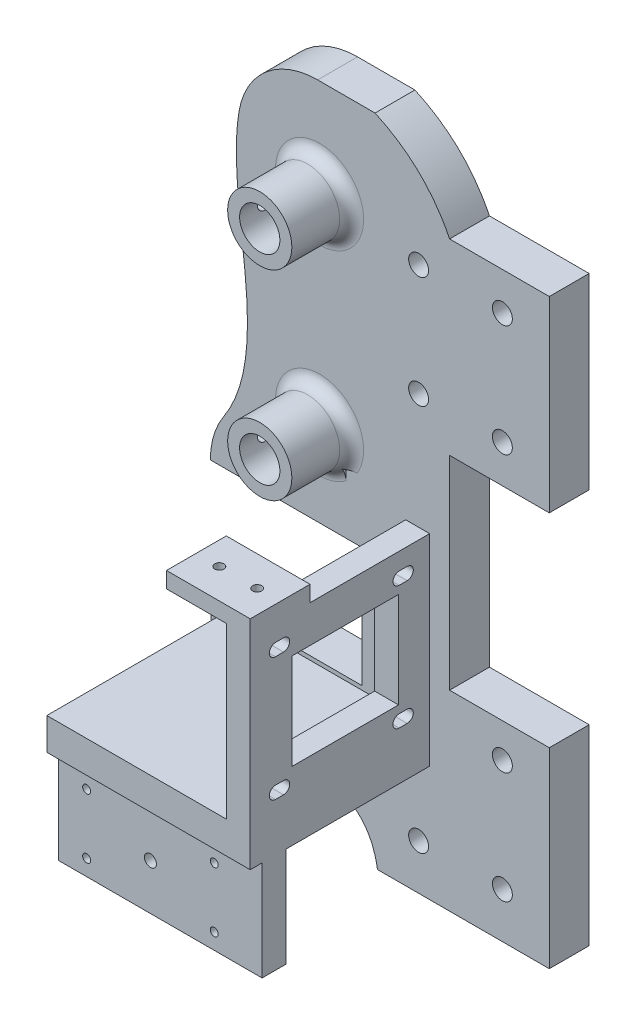
from build123d import *

# Parameters (mm, degrees)
SKETCH1_W               = 60
SKETCH1_H               = 145
BOSS_EXTRUDE1_DEPTH     = 10
BOSS_EXTRUDE2_DEPTH     = 45
SKETCH6_W               = 26.7
SKETCH6_H               = 24
CUT_EXTRUDE2_DEPTH      = 6
SKETCH8_R               = 1.15
CUT_EXTRUDE3_DEPTH      = 3
SKETCH9_W               = 60
SKETCH9_H               = 10
BOSS_EXTRUDE4_DEPTH     = 35
SKETCH12_W              = 6
SKETCH12_H              = 25
BOSS_EXTRUDE7_DEPTH     = 51
SKETCH13_R              = 8.05
SKETCH13_R_2            = 5.05
BOSS_EXTRUDE8_DEPTH     = 15
FILLET1_R               = 3
CUT_EXTRUDE4_REACH      = 160.348
CUT_EXTRUDE4_END_RADIUS = 8.05
SKETCH15_R              = 1.5
MIRROR1_START           = 9
MIRROR1_OUTLINE_R       = 8.05
MIRROR1_OUTLINE_R_2     = 5.05
MIRROR1_DEPTH           = 8.499999899
MIRROR1_START_2         = 20.499999166
MIRROR1_2_OUTLINE_R     = 8.05
MIRROR1_2_OUTLINE_R_2   = 5.05
MIRROR1_2_DEPTH         = 4.500000834
MIRROR1_START_3         = 17.499999899
MIRROR1_3_OUTLINE_R     = 8.05
MIRROR1_3_OUTLINE_R_2   = 5.05
MIRROR1_3_DEPTH         = 2.999999267
MIRROR1_START_4         = 18
MIRROR1_5_OUTLINE_R     = 1.5
MIRROR1_5_DEPTH         = 4.583753541
SKETCH17_W              = 10
SKETCH17_H              = 47
BOSS_EXTRUDE9_DEPTH     = 25
SKETCH18_W              = 10
SKETCH18_H              = 48
BOSS_EXTRUDE10_DEPTH    = 25
SKETCH19_R              = 2.5
CUT_EXTRUDE5_DEPTH      = 10
SKETCH20_W              = 60
SKETCH20_H              = 16
CUT_EXTRUDE6_DEPTH      = 10
CUT_EXTRUDE7_DEPTH      = 10
CUT_EXTRUDE8_DEPTH      = 10
FILLET2_R               = 20
CUT_EXTRUDE9_DEPTH      = 10
CUT_EXTRUDE10_DEPTH     = 101.361917618
CUT_EXTRUDE11_START     = -21
SKETCH26_W              = 30
SKETCH26_H              = 4
CUT_EXTRUDE11_DEPTH     = 21
SKETCH28_W              = 38
SKETCH28_H              = 30
CUT_EXTRUDE12_DEPTH     = 10
SKETCH29_R              = 1
SKETCH29_R_2            = 1.5
CUT_EXTRUDE13_DEPTH     = 12


with BuildPart() as part:
    # Sketch1 → Boss-Extrude1 (new body)
    with BuildSketch(Plane.XY):
        with Locations((30, 72.5)):
            Rectangle(SKETCH1_W, SKETCH1_H)
    extrude(amount=BOSS_EXTRUDE1_DEPTH)

    # Sketch2 → Boss-Extrude2 (add)
    with BuildSketch(Plane.XY.offset(10)):
        Polygon((4, 18), (49, 18), (49, 60.5), (34, 60.5), (34, 64.5), (55, 64.5), (55, 10), (4, 10), align=None)
    extrude(amount=BOSS_EXTRUDE2_DEPTH)

    # Sketch6 → Cut-Extrude2 (cut)
    with BuildSketch(Plane(origin=(55, 0, 0), x_dir=(0, 0, -1), z_dir=(1, 0, 0))):
        with Locations((-31.15, 39.2)):
            Rectangle(SKETCH6_W, SKETCH6_H)
    extrude(amount=-CUT_EXTRUDE2_DEPTH, mode=Mode.SUBTRACT)

    # Sketch8 → Cut-Extrude3 (cut)
    with BuildSketch(Plane(origin=(0, 64.5, 0), x_dir=(1, 0, 0), z_dir=(0, 1, 0))):
        with Locations(Location((49.25, -47.5, 0), (0, 0, 270))):
            Circle(SKETCH8_R)
        with Locations(Location((39.75, -47.5, 0), (0, 0, 270))):
            Circle(SKETCH8_R)
    extrude(amount=-CUT_EXTRUDE3_DEPTH, mode=Mode.SUBTRACT)

    # Sketch9 → Boss-Extrude4 (add)
    with BuildSketch(Plane.XZ):
        with Locations((30, 5)):
            Rectangle(SKETCH9_W, SKETCH9_H)
    extrude(amount=BOSS_EXTRUDE4_DEPTH)

    # Sketch12 → Boss-Extrude7 (add)
    with BuildSketch(Plane.ZY.offset(-4)):
        with Locations((49.02, -2.5)):
            Rectangle(SKETCH12_W, SKETCH12_H)
    extrude(amount=-BOSS_EXTRUDE7_DEPTH)

    # Sketch13 → Boss-Extrude8 (add)
    with BuildSketch(Plane.XY.offset(10)):
        with Locations(Location((27.39, 120.43, 0), (0, 0, 180))):
            Circle(SKETCH13_R)
        with Locations((27.39, 120.43)):
            Circle(SKETCH13_R_2, mode=Mode.SUBTRACT)
    extrude(amount=BOSS_EXTRUDE8_DEPTH)

    # Fillet1
    fillet1_edges = [part.edges().sort_by_distance(p)[0] for p in [
        (35.44, 120.43, 10),
    ]]
    fillet(fillet1_edges, radius=FILLET1_R)

    # Cut-Extrude4: up to this cylinder (the profile starts inside it)
    cut_extrude4_end = Plane(origin=(27.39, 120.43, 19), z_dir=(0, 0, -1)) * Cylinder(CUT_EXTRUDE4_END_RADIUS, 337.796, mode=Mode.PRIVATE)
    # Sketch15 → Cut-Extrude4 (cut, up to the surface)
    with BuildSketch(Plane.ZY.offset(-32), mode=Mode.PRIVATE) as cut_extrude4_sk1:
        with Locations(Location((19, 120.48, 0), (0, 0, 180))):
            Circle(SKETCH15_R)
    cut_extrude4_tool1 = extrude(cut_extrude4_sk1.sketch, amount=CUT_EXTRUDE4_REACH, mode=Mode.PRIVATE) & cut_extrude4_end
    add(cut_extrude4_tool1.solids().sort_by_distance((32, 120.48, 19))[0], mode=Mode.SUBTRACT)

    # Mirror1: read off the stored shape, not the designer's step
    # Mirror1 outline → Mirror1 (add)
    with BuildSketch(Plane.XY.offset(MIRROR1_START)):
        with Locations((27.39, 70.31)):
            Circle(MIRROR1_OUTLINE_R)
        with Locations((27.39, 70.31)):
            Circle(MIRROR1_OUTLINE_R_2, mode=Mode.SUBTRACT)
    extrude(amount=MIRROR1_DEPTH)



with BuildPart() as body_2:
    # Mirror1 2 outline → Mirror1 2 (new body)
    with BuildSketch(Plane.XY.offset(MIRROR1_START_2)):
        with Locations((27.39, 70.31)):
            Circle(MIRROR1_2_OUTLINE_R)
        with Locations((27.39, 70.31)):
            Circle(MIRROR1_2_OUTLINE_R_2, mode=Mode.SUBTRACT)
    extrude(amount=MIRROR1_2_DEPTH)


with BuildPart() as part_1:
    add(part.part)

    add(body_2.part)  # Mirror1 3 merges body 2
    # Mirror1 3 outline → Mirror1 3 (add)
    with BuildSketch(Plane.XY.offset(MIRROR1_START_3)):
        with Locations((27.39, 70.31)):
            Circle(MIRROR1_3_OUTLINE_R)
        with Locations((27.39, 70.31)):
            Circle(MIRROR1_3_OUTLINE_R_2, mode=Mode.SUBTRACT)
    extrude(amount=MIRROR1_3_DEPTH)

    # Mirror1 4 outline → Mirror1 4 (revolve)
    with BuildSketch(Plane(origin=(27.39, 70.31, 0), x_dir=(1, 0, 0), z_dir=(0, -1, 0))):
        with BuildLine():
            Line((8.05, 10), (11.05, 10))
            ThreePointArc((11.05, 10), (8.928679656, 10.878679656), (8.05, 13))
            Line((8.05, 13), (8.05, 10))
        make_face()
    revolve(axis=Axis((27.39, 70.31, 0), (0, 0, 1)))

    # Mirror1 5 outline → Mirror1 5 (cut)
    with BuildSketch(Plane.YZ.offset(MIRROR1_START_4)):
        with Locations((70.26, 19)):
            Circle(MIRROR1_5_OUTLINE_R)
    extrude(amount=MIRROR1_5_DEPTH, mode=Mode.SUBTRACT)

    # Sketch17 → Boss-Extrude9 (add)
    with BuildSketch(Plane(origin=(60, 0, 0), x_dir=(0, 0, -1), z_dir=(1, 0, 0))):
        with Locations((-5, 103.5)):
            Rectangle(SKETCH17_W, SKETCH17_H)
    extrude(amount=BOSS_EXTRUDE9_DEPTH)

    # Sketch18 → Boss-Extrude10 (add)
    with BuildSketch(Plane(origin=(60, 0, 0), x_dir=(0, 0, -1), z_dir=(1, 0, 0))):
        with Locations((-5, 5)):
            Rectangle(SKETCH18_W, SKETCH18_H)
    extrude(amount=BOSS_EXTRUDE10_DEPTH)

    # Sketch19 → Cut-Extrude5 (cut)
    with BuildSketch(Plane(origin=(0, 0, 0), x_dir=(-1, 0, 0), z_dir=(0, 0, -1))):
        with Locations((-73.238071341, 117.5)):
            Circle(SKETCH19_R)
        with Locations((-52.238071341, 117.5)):
            Circle(SKETCH19_R)
        with Locations((-52.238071341, 89.5)):
            Circle(SKETCH19_R)
        with Locations((-73.238071341, 89.5)):
            Circle(SKETCH19_R)
    cut_extrude5 = extrude(amount=-CUT_EXTRUDE5_DEPTH, mode=Mode.SUBTRACT)

    # Mirror2: Cut-Extrude5 across plane
    add(cut_extrude5.mirror(Plane.ZX.offset(54.95)), mode=Mode.SUBTRACT)

    # Sketch20 → Cut-Extrude6 (cut)
    with BuildSketch(Plane(origin=(0, 0, 0), x_dir=(-1, 0, 0), z_dir=(0, 0, -1))):
        with Locations((-30, -27)):
            Rectangle(SKETCH20_W, SKETCH20_H)
    extrude(amount=-CUT_EXTRUDE6_DEPTH, mode=Mode.SUBTRACT)

    # Sketch21 → Cut-Extrude7 (cut)
    with BuildSketch(Plane(origin=(0, 0, 0), x_dir=(-1, 0, 0), z_dir=(0, 0, -1))):
        with BuildLine():
            Line((-41.91493827, -19), (0, -19))
            Line((0, -19), (0, 9.855190418))
            add(Edge.make_bspline(
                [(0, 9.855190418), (-7.991882229, -11.003231013), (-38.248988904, 4.307186348), (-41.91493827, -19)],
                knots=[0, 0, 0, 0, 1, 1, 1, 1], degree=3))
        make_face()
    extrude(amount=-CUT_EXTRUDE7_DEPTH, mode=Mode.SUBTRACT)

    # Sketch22 → Cut-Extrude8 (cut)
    with BuildSketch(Plane.XY.offset(10)):
        with BuildLine():
            Line((14.869359674, 145), (0, 145))
            Line((0, 145), (0, 55.753772628))
            add(Edge.make_bspline(
                [(0, 55.753772628), (22.996880837, 81.13600087), (-6.640389726, 120.566568951), (14.869359674, 145)],
                knots=[0, 0, 0, 0, 1, 1, 1, 1], degree=3))
        make_face()
    extrude(amount=-CUT_EXTRUDE8_DEPTH, mode=Mode.SUBTRACT)

    # Fillet2
    fillet2_edges = [part_1.edges().sort_by_distance(p)[0] for p in [
        (0, 9.855190418, 5),
        (0, 55.753772628, 5),
        (14.869359674, 145, 5),
    ]]
    fillet(fillet2_edges, radius=FILLET2_R)

    # Sketch23 → Cut-Extrude9 (cut)
    with BuildSketch(Plane.XY.offset(10)):
        with BuildLine():
            Line((41.308294674, 145), (60, 145))
            Line((60, 145), (60, 127))
            add(Edge.make_bspline(
                [(60, 127), (54.009421291, 139.215727594), (41.308294674, 145)],
                knots=[0, 0, 0, 1, 1, 1], degree=2))
        make_face()
    extrude(amount=-CUT_EXTRUDE9_DEPTH, mode=Mode.SUBTRACT)

    # Sketch24 → Cut-Extrude10 (cut)
    with BuildSketch(Plane(origin=(55, 0, 0), x_dir=(0, 0, -1), z_dir=(1, 0, 0))):
        with BuildLine():
            Line((-46.65, 53.1), (-48.65, 53.1))
            ThreePointArc((-48.65, 53.1), (-50.2, 54.65), (-48.65, 56.2))
            Line((-48.65, 56.2), (-46.65, 56.2))
            ThreePointArc((-46.65, 56.2), (-45.1, 54.65), (-46.65, 53.1))
        make_face()
        with BuildLine():
            Line((-15.65, 53.1), (-17.65, 53.1))
            ThreePointArc((-17.65, 53.1), (-19.2, 54.65), (-17.65, 56.2))
            Line((-17.65, 56.2), (-15.65, 56.2))
            ThreePointArc((-15.65, 56.2), (-14.1, 54.65), (-15.65, 53.1))
        make_face()
        with BuildLine():
            Line((-15.65, 22.1), (-17.65, 22.1))
            ThreePointArc((-17.65, 22.1), (-19.2, 23.65), (-17.65, 25.2))
            Line((-17.65, 25.2), (-15.65, 25.2))
            ThreePointArc((-15.65, 25.2), (-14.1, 23.65), (-15.65, 22.1))
        make_face()
        with BuildLine():
            Line((-46.65, 22.1), (-48.65, 22.1))
            ThreePointArc((-48.65, 22.1), (-50.2, 23.65), (-48.65, 25.2))
            Line((-48.65, 25.2), (-46.65, 25.2))
            ThreePointArc((-46.65, 25.2), (-45.1, 23.65), (-46.65, 22.1))
        make_face()
    extrude(amount=-CUT_EXTRUDE10_DEPTH, mode=Mode.SUBTRACT)

    # Sketch26 → Cut-Extrude11 (cut)
    with BuildSketch(Plane.ZY.offset(-34).offset(CUT_EXTRUDE11_START)):
        with Locations((25, 62.5)):
            Rectangle(SKETCH26_W, SKETCH26_H)
    extrude(amount=CUT_EXTRUDE11_DEPTH, mode=Mode.SUBTRACT)

    # Sketch28 → Cut-Extrude12 (cut)
    with BuildSketch(Plane(origin=(0, 0, 0), x_dir=(-1, 0, 0), z_dir=(0, 0, -1))):
        with Locations((-19, 34.007303443)):
            Rectangle(SKETCH28_W, SKETCH28_H)
    extrude(amount=-CUT_EXTRUDE12_DEPTH, mode=Mode.SUBTRACT)

    # Sketch29 → Cut-Extrude13 (cut)
    with BuildSketch(Plane(origin=(0, 0, 46.02), x_dir=(-1, 0, 0), z_dir=(0, 0, -1))):
        with Locations((-11, -11)):
            Circle(SKETCH29_R)
        with Locations((-27, -3.5)):
            Circle(SKETCH29_R_2)
        with Locations((-11, 4)):
            Circle(SKETCH29_R)
        with Locations((-43, 4)):
            Circle(SKETCH29_R)
        with Locations((-43, -11)):
            Circle(SKETCH29_R)
    extrude(amount=-CUT_EXTRUDE13_DEPTH, mode=Mode.SUBTRACT)


solid = part_1.part
